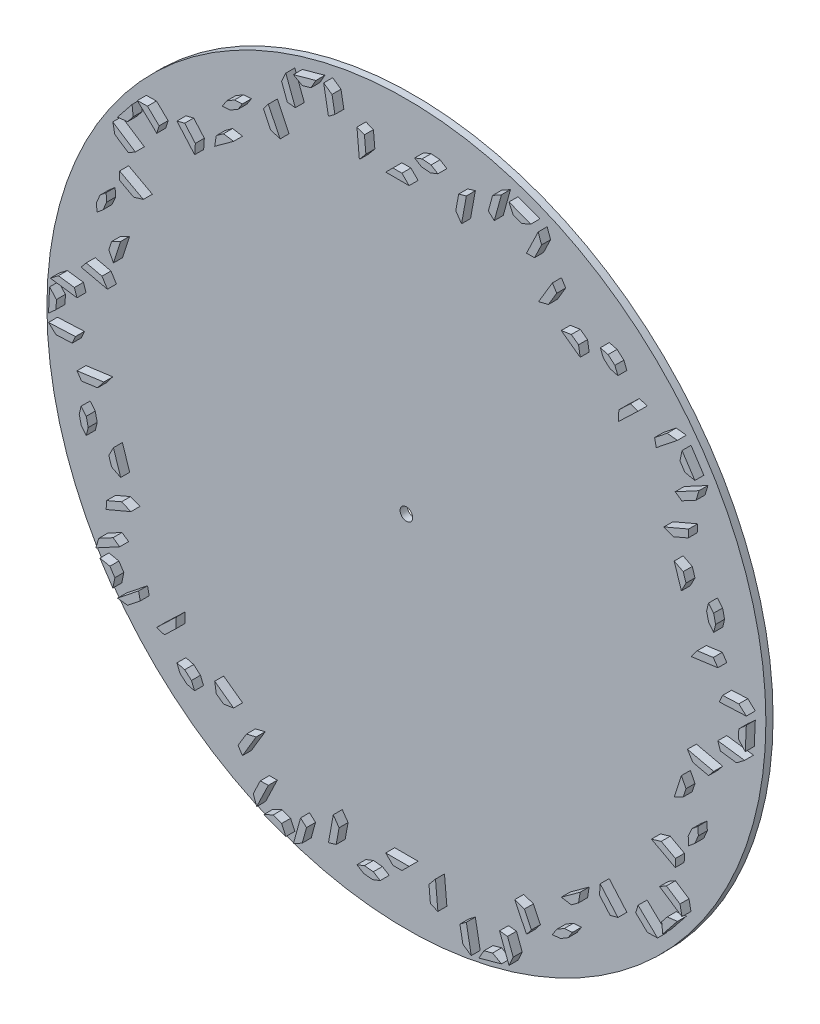
from build123d import *

# Parameters (mm, degrees)
SKETCH1_R           = 100
SKETCH1_R_2         = 1.75
BOSS_EXTRUDE1_DEPTH = 2
BOSS_EXTRUDE2_DEPTH = 2.5


with BuildPart() as part:
    # Sketch1 → Boss-Extrude1 (new body)
    with BuildSketch(Plane.XY):
        Circle(SKETCH1_R)
        Circle(SKETCH1_R_2, mode=Mode.SUBTRACT)
    extrude(amount=BOSS_EXTRUDE1_DEPTH)

    # Sketch3 → Boss-Extrude2 (add)
    with BuildSketch(Plane.XY.offset(2)):
        Polygon((3.25, -82), (-3.25, -82), (-1.25, -84), (1.25, -84), align=None)
        Polygon((-9.178046705, -88.031675882), (-11.259634602, -88.848371559), (-9.357325323, -90.02362447), (-6.867389588, -90.247722743), (-4.785801691, -89.431027067), (-6.68811097, -88.255774155), align=None)
        Polygon((-16.228691149, -82.426889324), (-17.839436536, -80.101916357), (-19.178613247, -87.481388271), (-17.032197175, -86.854572472), align=None)
        Polygon((-25.2812881, -86.906092836), (-26.943176975, -85.410056284), (-28.938453317, -92.639777739), (-26.478453905, -91.243925709), align=None)
        Polygon((-34.550901876, -88.503094181), (-37.126121265, -89.672814274), (-31.040594606, -91.95675063), (-32.210314699, -89.381531241), align=None)
        Polygon((-39.158573874, -88.804102339), (-35.90444583, -82.046835829), (-38.140267305, -82.080037219), (-40.092744131, -86.134397125), align=None)
        Polygon((-43.114526749, -78.498089679), (-39.267782168, -72.059723727), (-42.01047831, -72.750822759), (-44.318525058, -76.613842331), align=None)
        Polygon((-45.569085456, -68.249695609), (-50.82769592, -64.429091469), (-50.385232436, -67.222695962), (-48.36268995, -68.692159093), align=None)
        Polygon((-59.168916578, -65.824401334), (-61.332998236, -65.261595348), (-60.48479403, -67.330544266), (-58.602115365, -68.975391081), (-56.438033707, -69.538197067), (-57.286237913, -67.469248149), align=None)
        Polygon((-61.578596873, -57.145768935), (-61.515132443, -54.318053909), (-66.936093922, -59.501023777), (-64.83117376, -60.255550856), align=None)
        Polygon((-71.535111416, -55.448537715), (-72.000259537, -53.261384948), (-77.863995655, -57.937558462), (-75.053353087, -58.254241823), align=None)
        Polygon((-79.97308033, -51.291996671), (-82.744020801, -50.724644126), (-79.163190421, -56.149370275), (-78.595837877, -53.378429805), align=None)
        Polygon((-83.877693437, -48.827195738), (-77.273226948, -45.27318077), (-79.101559805, -43.985858369), (-83.064239698, -46.11826735), align=None)
        Polygon((-81.02040429, -38.164205594), (-74.123945996, -35.216517856), (-76.749051605, -34.163512375), (-80.886926581, -35.932125017), align=None)
        Polygon((-76.982329104, -28.430327217), (-78.990939568, -22.248459861), (-80.275018612, -24.768606882), (-79.502476126, -27.146248173), align=None)
        Polygon((-86.559271396, -18.474442765), (-87.979241176, -16.747107874), (-88.50912722, -18.919484633), (-87.952824885, -21.356804413), (-86.532855105, -23.084139304), (-86.002969061, -20.911762545), align=None)
        Polygon((-83.407571571, -10.036907126), (-81.694138579, -7.786541071), (-89.126261792, -8.793290565), (-87.866845499, -10.640956823), align=None)
        Polygon((-90.46495356, -2.811525814), (-89.555690154, -0.76867485), (-97.048138153, -1.105161078), (-94.960422359, -3.01341755), align=None)
        Polygon((-94.848260283, 5.510900216), (-96.756516756, 7.59861601), (-97.048138153, 1.105161078), (-94.960422359, 3.01341755), align=None)
        Polygon((-96.558385005, 9.800040059), (-89.126261792, 8.793290565), (-89.848745022, 10.909423354), (-94.30801895, 11.51347305), align=None)
        Polygon((-87.979241176, 16.747107874), (-80.667281834, 15.07820087), (-82.172095791, 17.473098562), (-86.559271396, 18.474442765), align=None)
        Polygon((-78.990939568, 22.248459861), (-76.982329104, 28.430327217), (-79.502476126, 27.146248173), (-80.275018612, 24.768606882), align=None)
        Polygon((-80.886926581, 35.932125017), (-81.02040429, 38.164205594), (-82.725982126, 36.71817508), (-83.708544705, 34.419355649), (-83.575066996, 32.187275072), (-81.86948916, 33.633305586), align=None)
        Polygon((-73.377688848, 40.905712063), (-70.668760459, 41.719165801), (-77.273226948, 45.27318077), (-77.340368741, 43.038121044), align=None)
        Polygon((-74.840258235, 50.899393389), (-72.903891018, 52.017642915), (-79.163190421, 56.149370275), (-78.595837877, 53.378429805), align=None)
        Polygon((-73.494628582, 60.20882053), (-73.811311943, 63.019463098), (-77.863995655, 57.937558462), (-75.053353087, 58.254241823), align=None)
        Polygon((-72.3570554, 64.683993644), (-66.936093922, 59.501023777), (-66.276763488, 61.637676154), (-69.529340375, 64.747458074), align=None)
        Polygon((-61.332998236, 65.261595348), (-56.398457792, 59.613559353), (-56.208192311, 62.435579737), (-59.168916578, 65.824401334), align=None)
        Polygon((-50.82769592, 64.429091469), (-45.569085456, 68.249695609), (-48.36268995, 68.692159093), (-50.385232436, 67.222695962), align=None)
        Polygon((-44.318525058, 76.613842331), (-43.114526749, 78.498089679), (-45.344323613, 78.330739918), (-47.490445597, 77.048491724), (-48.694443907, 75.164244376), (-46.464647042, 75.331594137), align=None)
        Polygon((-35.320023001, 76.223739578), (-32.650317787, 75.28956932), (-35.90444583, 82.046835829), (-37.272499827, 80.278099483), align=None)
        Polygon((-30.629127991, 85.168474323), (-28.405283426, 84.934989101), (-31.040594606, 91.95675063), (-32.210314699, 89.381531241), align=None)
        Polygon((-24.068546753, 91.909017823), (-22.672694723, 94.369017236), (-28.938453317, 92.639777739), (-26.478453905, 91.243925709), align=None)
        Polygon((-20.517789958, 94.860860186), (-19.178613247, 87.481388271), (-17.389310965, 88.82243165), (-18.192816992, 93.250114798), align=None)
        Polygon((-11.259634602, 88.848371559), (-10.587339786, 81.378564354), (-8.774669815, 83.549791559), (-9.178046705, 88.031675882), align=None)
        Polygon((-3.25, 82), (3.25, 82), (1.25, 84), (-1.25, 84), align=None)
        Polygon((9.178046705, 88.031675882), (11.259634602, 88.848371559), (9.357325323, 90.02362447), (6.867389588, 90.247722743), (4.785801691, 89.431027067), (6.68811097, 88.255774155), align=None)
        Polygon((16.228691149, 82.426889324), (17.839436536, 80.101916357), (19.178613247, 87.481388271), (17.032197175, 86.854572472), align=None)
        Polygon((25.2812881, 86.906092836), (26.943176975, 85.410056284), (28.938453317, 92.639777739), (26.478453905, 91.243925709), align=None)
        Polygon((34.550901876, 88.503094181), (37.126121265, 89.672814274), (31.040594606, 91.95675063), (32.210314699, 89.381531241), align=None)
        Polygon((39.158573874, 88.804102339), (35.90444583, 82.046835829), (38.140267305, 82.080037219), (40.092744131, 86.134397125), align=None)
        Polygon((43.114526749, 78.498089679), (39.267782168, 72.059723727), (42.01047831, 72.750822759), (44.318525058, 76.613842331), align=None)
        Polygon((45.569085456, 68.249695609), (50.82769592, 64.429091469), (50.385232436, 67.222695962), (48.36268995, 68.692159093), align=None)
        Polygon((59.168916578, 65.824401334), (61.332998236, 65.261595348), (60.48479403, 67.330544266), (58.602115365, 68.975391081), (56.438033707, 69.538197067), (57.286237913, 67.469248149), align=None)
        Polygon((61.578596873, 57.145768935), (61.515132443, 54.318053909), (66.936093922, 59.501023777), (64.83117376, 60.255550856), align=None)
        Polygon((71.535111416, 55.448537715), (72.000259537, 53.261384948), (77.863995655, 57.937558462), (75.053353087, 58.254241823), align=None)
        Polygon((79.97308033, 51.291996671), (82.744020801, 50.724644126), (79.163190421, 56.149370275), (78.595837877, 53.378429805), align=None)
        Polygon((83.877693437, 48.827195738), (77.273226948, 45.27318077), (79.101559805, 43.985858369), (83.064239698, 46.11826735), align=None)
        Polygon((81.02040429, 38.164205594), (74.123945996, 35.216517856), (76.749051605, 34.163512375), (80.886926581, 35.932125017), align=None)
        Polygon((76.982329104, 28.430327217), (78.990939568, 22.248459861), (80.275018612, 24.768606882), (79.502476126, 27.146248173), align=None)
        Polygon((86.559271396, 18.474442765), (87.979241176, 16.747107874), (88.50912722, 18.919484633), (87.952824885, 21.356804413), (86.532855105, 23.084139304), (86.002969061, 20.911762545), align=None)
        Polygon((83.407571571, 10.036907126), (81.694138579, 7.786541071), (89.126261792, 8.793290565), (87.866845499, 10.640956823), align=None)
        Polygon((90.46495356, 2.811525814), (89.555690154, 0.76867485), (97.048138153, 1.105161078), (94.960422359, 3.01341755), align=None)
        Polygon((94.848260283, -5.510900216), (96.756516756, -7.59861601), (97.048138153, -1.105161078), (94.960422359, -3.01341755), align=None)
        Polygon((96.558385005, -9.800040059), (89.126261792, -8.793290565), (89.848745022, -10.909423354), (94.30801895, -11.51347305), align=None)
        Polygon((87.979241176, -16.747107875), (80.667281834, -15.07820087), (82.172095791, -17.473098562), (86.559271396, -18.474442765), align=None)
        Polygon((78.990939568, -22.248459861), (76.982329104, -28.430327217), (79.502476126, -27.146248173), (80.275018612, -24.768606882), align=None)
        Polygon((80.886926581, -35.932125017), (81.02040429, -38.164205594), (82.725982126, -36.71817508), (83.708544705, -34.419355649), (83.575066996, -32.187275072), (81.86948916, -33.633305586), align=None)
        Polygon((73.377688848, -40.905712063), (70.668760459, -41.719165801), (77.273226948, -45.27318077), (77.340368741, -43.038121044), align=None)
        Polygon((74.840258235, -50.899393389), (72.903891018, -52.017642915), (79.163190421, -56.149370275), (78.595837877, -53.378429805), align=None)
        Polygon((73.494628582, -60.20882053), (73.811311943, -63.019463098), (77.863995655, -57.937558462), (75.053353087, -58.254241823), align=None)
        Polygon((72.3570554, -64.683993644), (66.936093922, -59.501023777), (66.276763488, -61.637676154), (69.529340375, -64.747458074), align=None)
        Polygon((61.332998236, -65.261595348), (56.398457792, -59.613559353), (56.208192311, -62.435579737), (59.168916578, -65.824401334), align=None)
        Polygon((50.82769592, -64.429091469), (45.569085456, -68.249695609), (48.36268995, -68.692159093), (50.385232436, -67.222695962), align=None)
        Polygon((44.318525058, -76.613842331), (43.114526749, -78.498089679), (45.344323613, -78.330739918), (47.490445597, -77.048491724), (48.694443907, -75.164244376), (46.464647042, -75.331594137), align=None)
        Polygon((35.320023001, -76.223739578), (32.650317787, -75.28956932), (35.90444583, -82.046835829), (37.272499827, -80.278099483), align=None)
        Polygon((30.629127991, -85.168474323), (28.405283426, -84.934989101), (31.040594606, -91.95675063), (32.210314699, -89.381531241), align=None)
        Polygon((24.068546753, -91.909017823), (22.672694723, -94.369017236), (28.938453317, -92.639777739), (26.478453905, -91.243925709), align=None)
        Polygon((20.517789958, -94.860860186), (19.178613247, -87.481388271), (17.389310965, -88.82243165), (18.192816992, -93.250114798), align=None)
        Polygon((11.259634602, -88.848371559), (10.587339786, -81.378564354), (8.774669815, -83.549791559), (9.178046705, -88.031675882), align=None)
    extrude(amount=BOSS_EXTRUDE2_DEPTH)


solid = part.part
